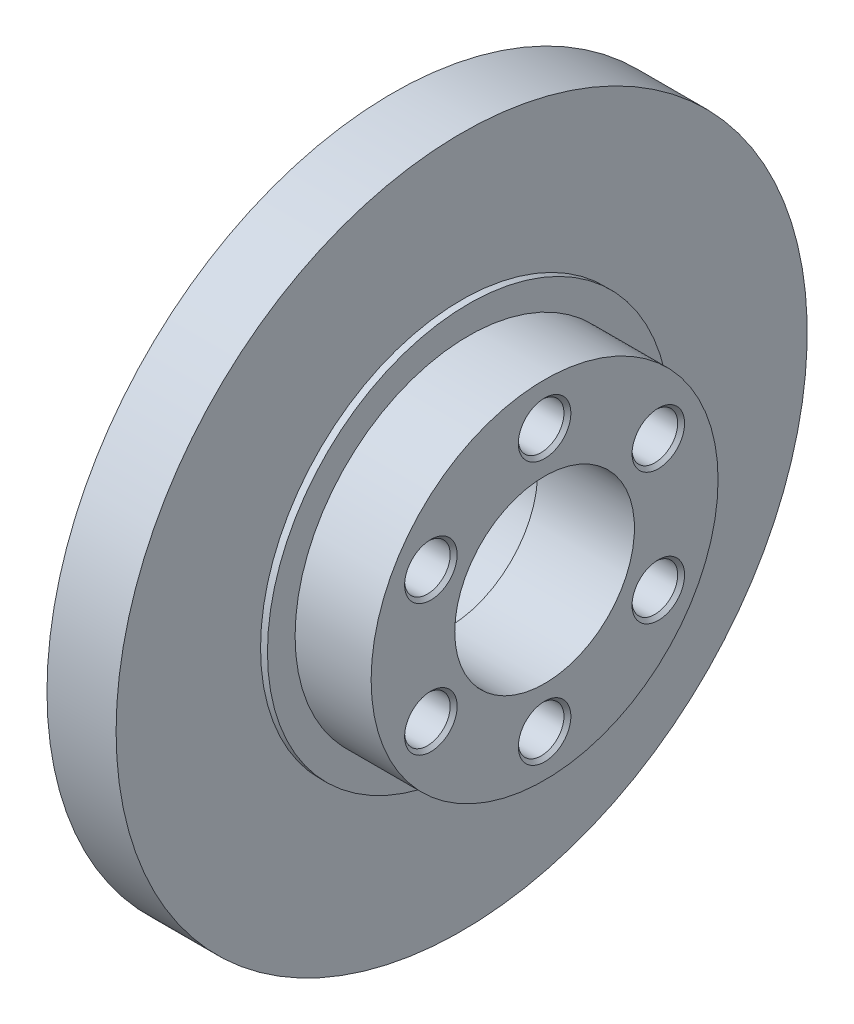
from build123d import *

# Parameters (mm, degrees)
SKETCH3_R          = 2.5
CUT_EXTRUDE1_DEPTH = 4
SKETCH4_R          = 3.3
CUT_EXTRUDE2_DEPTH = 10
CHAMFER1_SIZE      = 0.5


with BuildPart() as part:
    # Sketch2 → Revolve1 (revolve)
    with BuildSketch(Plane.XY):
        Polygon((0, 50), (10, 50), (10, 29.1), (11, 29.1), (11, 25.1), (22, 25.1), (22, 13), (8, 13), (8, 14), (0, 14), align=None)
    revolve(axis=Axis((0, 0, 0), (1, 0, 0)))

    # Sketch3 → Cut-Extrude1 (cut)
    with BuildSketch(Plane(origin=(0, 0, 0), x_dir=(0, 0, -1), z_dir=(1, 0, 0))):
        with Locations((0, 40)):
            Circle(SKETCH3_R)
        with Locations((28.284271247, 28.284271247)):
            Circle(SKETCH3_R)
        with Locations((40, 0)):
            Circle(SKETCH3_R)
        with Locations((28.284271247, -28.284271247)):
            Circle(SKETCH3_R)
        with Locations((0, -40)):
            Circle(SKETCH3_R)
        with Locations((-28.284271247, -28.284271247)):
            Circle(SKETCH3_R)
        with Locations((-40, 0)):
            Circle(SKETCH3_R)
        with Locations((-28.284271247, 28.284271247)):
            Circle(SKETCH3_R)
    extrude(amount=CUT_EXTRUDE1_DEPTH, mode=Mode.SUBTRACT)

    # Sketch4 → Cut-Extrude2 (cut)
    with BuildSketch(Plane(origin=(22, 0, 0), x_dir=(0, 0, -1), z_dir=(1, 0, 0))):
        with Locations((0, 19)):
            Circle(SKETCH4_R)
        with Locations((16.454482672, 9.5)):
            Circle(SKETCH4_R)
        with Locations((16.454482672, -9.5)):
            Circle(SKETCH4_R)
        with Locations((0, -19)):
            Circle(SKETCH4_R)
        with Locations((-16.454482672, -9.5)):
            Circle(SKETCH4_R)
        with Locations((-16.454482672, 9.5)):
            Circle(SKETCH4_R)
    extrude(amount=-CUT_EXTRUDE2_DEPTH, mode=Mode.SUBTRACT)

    # Chamfer1
    chamfer1_edges = [part.edges().sort_by_distance(p)[0] for p in [
        (22, 9.5, 19.754482672),
        (22, -9.5, 19.754482672),
        (22, -19, 3.3),
        (22, -9.5, -13.154482672),
        (22, 9.5, -13.154482672),
        (22, 19, 3.3),
    ]]
    chamfer(chamfer1_edges, length=CHAMFER1_SIZE)


solid = part.part
